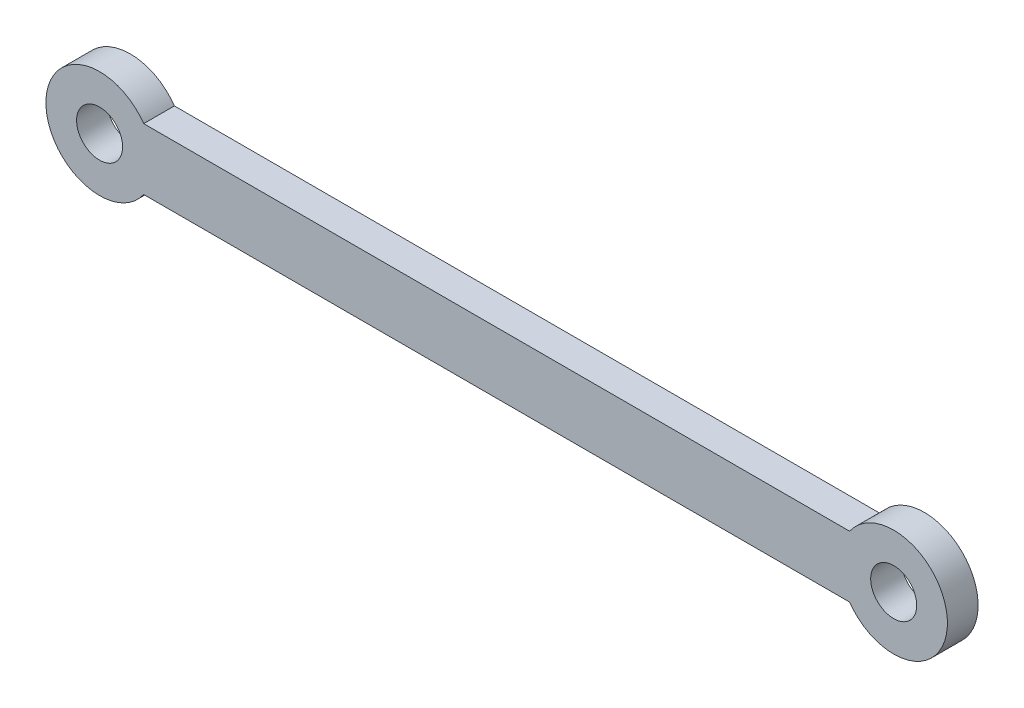
from build123d import *

# Parameters (mm, degrees)
CROQUIS1_R              = 1.5
SALIENTE_EXTRUIR1_DEPTH = 2


with BuildPart() as part:
    # Croquis1 → Saliente-Extruir1 (new body)
    with BuildSketch(Plane.XY):
        with BuildLine():
            Line((23, 2), (-23, 2))
            ThreePointArc((-23, 2), (-29.372281323, 0), (-23, -2))
            Line((-23, -2), (23, -2))
            ThreePointArc((23, -2), (29.372281323, 0), (23, 2))
        make_face()
        with Locations((-25.872281323, 0)):
            Circle(CROQUIS1_R, mode=Mode.SUBTRACT)
        with Locations((25.872281323, 0)):
            Circle(CROQUIS1_R, mode=Mode.SUBTRACT)
    extrude(amount=SALIENTE_EXTRUIR1_DEPTH)


solid = part.part
